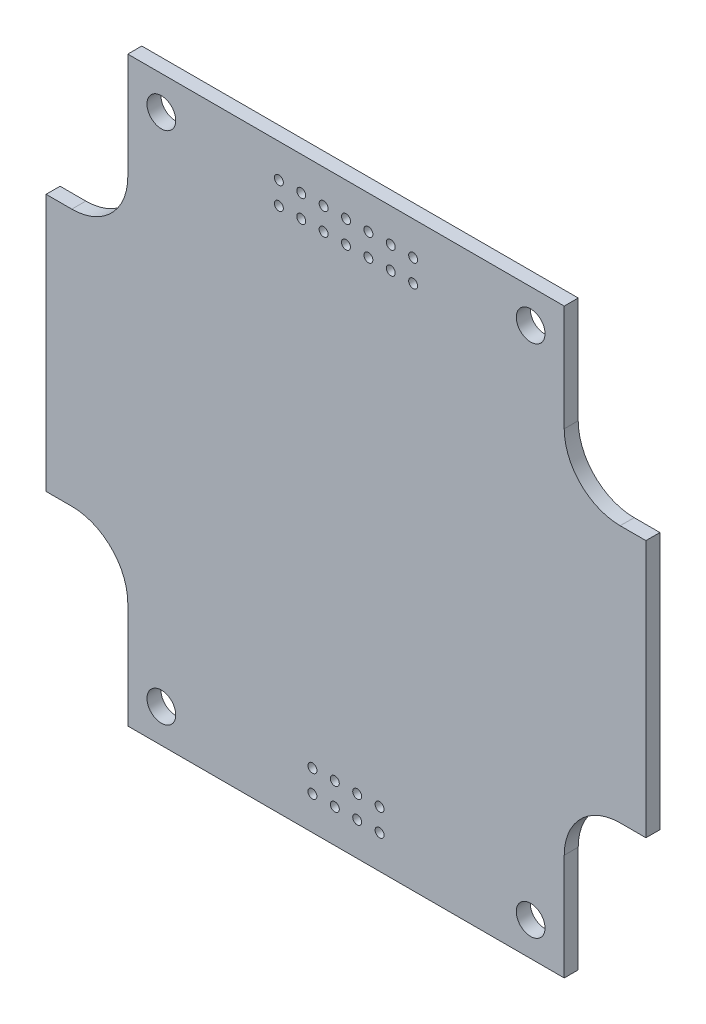
from build123d import *

# Parameters (mm, degrees)
BOSS_EXTRUDE1_DEPTH = 1.5875
SKETCH3_R           = 1.63195
CUT_EXTRUDE1_DEPTH  = 95.855674265
SKETCH4_R           = 0.508
CUT_EXTRUDE2_DEPTH  = 95.855674265


with BuildPart() as part:
    # Sketch1 → Boss-Extrude1 (new body)
    with BuildSketch(Plane.XY):
        with BuildLine():
            Line((0, 47.625), (0, 18.415))
            Line((0, 18.415), (2.921, 18.415))
            ThreePointArc((2.921, 18.415), (7.411128061, 16.555128061), (9.271, 12.065))
            Line((9.271, 12.065), (9.271, 0))
            Line((9.271, 0), (58.801, 0))
            Line((58.801, 0), (58.801, 12.065))
            ThreePointArc((58.801, 12.065), (60.660871939, 16.555128061), (65.151, 18.415))
            Line((65.151, 18.415), (68.072, 18.415))
            Line((68.072, 18.415), (68.072, 47.625))
            Line((68.072, 47.625), (65.151, 47.625))
            ThreePointArc((65.151, 47.625), (60.660871939, 49.484871939), (58.801, 53.975))
            Line((58.801, 53.975), (58.801, 66.04))
            Line((58.801, 66.04), (9.271, 66.04))
            Line((9.271, 66.04), (9.271, 53.975))
            ThreePointArc((9.271, 53.975), (7.411128061, 49.484871939), (2.921, 47.625))
            Line((2.921, 47.625), (0, 47.625))
        make_face()
    extrude(amount=BOSS_EXTRUDE1_DEPTH)

    # Sketch3 → Cut-Extrude1 (cut, through all)
    with BuildSketch(Plane.XY.offset(1.5875)):
        with Locations((13.081, 62.23)):
            Circle(SKETCH3_R)
        with Locations((54.991, 62.23)):
            Circle(SKETCH3_R)
        with Locations((54.991, 3.81)):
            Circle(SKETCH3_R)
        with Locations((13.081, 3.81)):
            Circle(SKETCH3_R)
    extrude(amount=-CUT_EXTRUDE1_DEPTH, mode=Mode.SUBTRACT)

    # Sketch4 → Cut-Extrude2 (cut, through all)
    with BuildSketch(Plane.XY.offset(1.5875)):
        with Locations((34.036, 62.23)):
            Circle(SKETCH4_R)
        with Locations((36.576, 62.23)):
            Circle(SKETCH4_R)
        with Locations((39.116, 62.23)):
            Circle(SKETCH4_R)
        with Locations((41.656, 62.23)):
            Circle(SKETCH4_R)
        with Locations((36.576, 59.69)):
            Circle(SKETCH4_R)
        with Locations((39.116, 59.69)):
            Circle(SKETCH4_R)
        with Locations((41.656, 59.69)):
            Circle(SKETCH4_R)
        with Locations((34.036, 59.69)):
            Circle(SKETCH4_R)
        with Locations((31.496, 62.23)):
            Circle(SKETCH4_R)
        with Locations((28.956, 62.23)):
            Circle(SKETCH4_R)
        with Locations((26.416, 62.23)):
            Circle(SKETCH4_R)
        with Locations((31.496, 59.69)):
            Circle(SKETCH4_R)
        with Locations((28.956, 59.69)):
            Circle(SKETCH4_R)
        with Locations((26.416, 59.69)):
            Circle(SKETCH4_R)
        with Locations((30.226, 6.35)):
            Circle(SKETCH4_R)
        with Locations((32.766, 6.35)):
            Circle(SKETCH4_R)
        with Locations((35.306, 6.35)):
            Circle(SKETCH4_R)
        with Locations((37.846, 6.35)):
            Circle(SKETCH4_R)
        with Locations((32.766, 3.81)):
            Circle(SKETCH4_R)
        with Locations((35.306, 3.81)):
            Circle(SKETCH4_R)
        with Locations((37.846, 3.81)):
            Circle(SKETCH4_R)
        with Locations((30.226, 3.81)):
            Circle(SKETCH4_R)
    extrude(amount=-CUT_EXTRUDE2_DEPTH, mode=Mode.SUBTRACT)


solid = part.part
